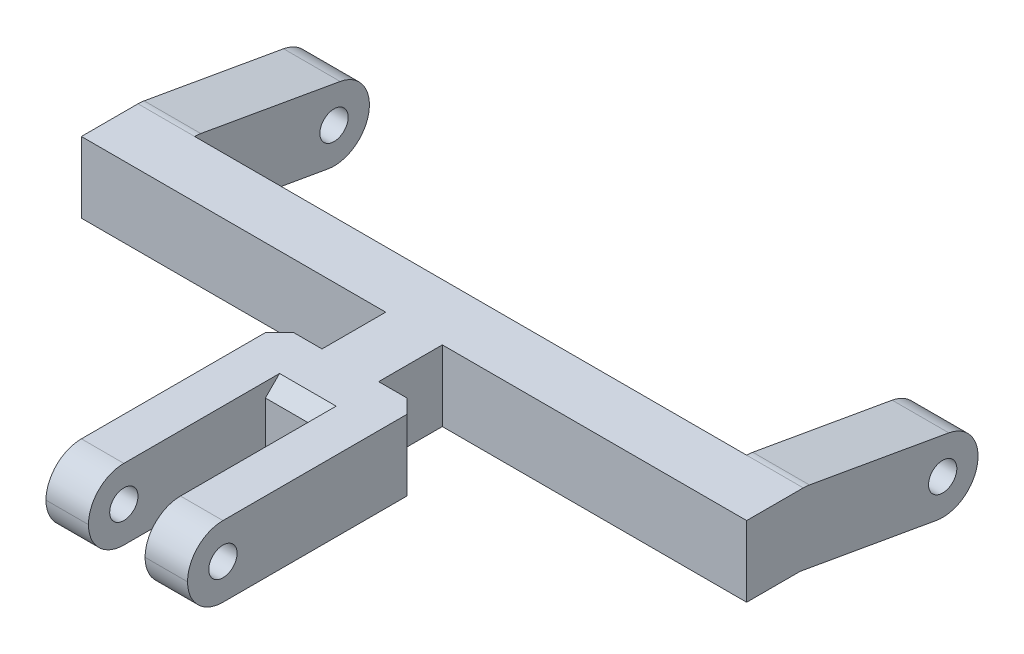
from build123d import *

# Parameters (mm, degrees)
EXTRUDE_1_DEPTH          = 10
FILLET_1_R               = 5
EXTRUDE_START            = 47
SKETCH_6_R               = 2
EXTRUDE_2_DEPTH          = 8
EXTRUDE_START_2          = -39
SKETCH_6_2_R             = 2
EXTRUDE_3_DEPTH          = 8
CUT_EXTRUDE_4_DEPTH      = 70.34695379
CUT_EXTRUDE_4_DEPTH_BACK = 70.34695379
SKETCH_7_R               = 2
CHAMFER_1_SIZE           = 2
CHAMFER_2_SIZE           = 2


with BuildPart() as part:
    # 草图1 → 凸台-拉伸1 (new body)
    with BuildSketch(Plane(origin=(0, 0, 0), x_dir=(1, 0, 0), z_dir=(0, 1, 0))):
        Polygon((-4, -50), (-10, -50), (-10, -17), (-4, -17), (-4, -8), (-47, -8), (-47, 0), (47, 0), (47, -8), (4, -8), (4, -17), (10, -17), (10, -50), (4, -50), (4, -25), (-4, -25), align=None)
    extrude(amount=EXTRUDE_1_DEPTH)

    # 圆角1
    fillet_1_edges = [part.edges().sort_by_distance(p)[0] for p in [
        (-7, 0, 50),
        (-7, 10, 50),
        (7, 10, 50),
        (7, 0, 50),
    ]]
    fillet(fillet_1_edges, radius=FILLET_1_R - 0.0001)  # a hair under: the kernel refuses the full size

    # 草图6 → 凸台-拉伸2 (add)
    with BuildSketch(Plane(origin=(0, 0, 0), x_dir=(0, 0, -1), z_dir=(1, 0, 0)).offset(EXTRUDE_START)):
        with BuildLine():
            Line((0.868240888, 9.924038765), (20.564395949, 6.451075212))
            ThreePointArc((20.564395949, 6.451075212), (24.620193825, 0.658795558), (18.827914172, -3.397002318))
            Line((18.827914172, -3.397002318), (-0.868240888, 0.075961235))
            ThreePointArc((-0.868240888, 0.075961235), (-4.924038765, 5.868240888), (0.868240888, 9.924038765))
        make_face()
        with Locations(Location((19.69615506, 1.527036447, 0), (0, 0, 180))):
            Circle(SKETCH_6_R, mode=Mode.SUBTRACT)
    extrude(amount=-EXTRUDE_2_DEPTH)

    # 草图6<2> → 凸台-拉伸3 (add)
    with BuildSketch(Plane(origin=(0, 0, 0), x_dir=(0, 0, -1), z_dir=(1, 0, 0)).offset(EXTRUDE_START_2)):
        with BuildLine():
            Line((0.868240888, 9.924038765), (20.564395949, 6.451075212))
            ThreePointArc((20.564395949, 6.451075212), (24.620193825, 0.658795558), (18.827914172, -3.397002318))
            Line((18.827914172, -3.397002318), (-0.868240888, 0.075961235))
            ThreePointArc((-0.868240888, 0.075961235), (-4.924038765, 5.868240888), (0.868240888, 9.924038765))
        make_face()
        with Locations(Location((19.69615506, 1.527036447, 0), (0, 0, 180))):
            Circle(SKETCH_6_2_R, mode=Mode.SUBTRACT)
    extrude(amount=-EXTRUDE_3_DEPTH)

    # 草图7 → 切除-拉伸4 (cut, two sides: drawn at the far end of the back side and taken through both)
    with BuildSketch(Plane(origin=(0, 0, 0), x_dir=(0, 0, -1), z_dir=(1, 0, 0)).offset(-CUT_EXTRUDE_4_DEPTH_BACK)):
        with Locations((-45, 5)):
            Circle(SKETCH_7_R)
    extrude(amount=CUT_EXTRUDE_4_DEPTH + CUT_EXTRUDE_4_DEPTH_BACK, mode=Mode.SUBTRACT)

    # 倒角1
    chamfer_1_edges = [part.edges().sort_by_distance(p)[0] for p in [
        (0, 0, 25),
        (0, 10, 25),
    ]]
    chamfer(chamfer_1_edges, length=CHAMFER_1_SIZE)

    # 倒角2
    chamfer_2_edges = [part.edges().sort_by_distance(p)[0] for p in [
        (10, 5, 17),
        (-10, 5, 17),
    ]]
    chamfer(chamfer_2_edges, length=CHAMFER_2_SIZE)


solid = part.part
